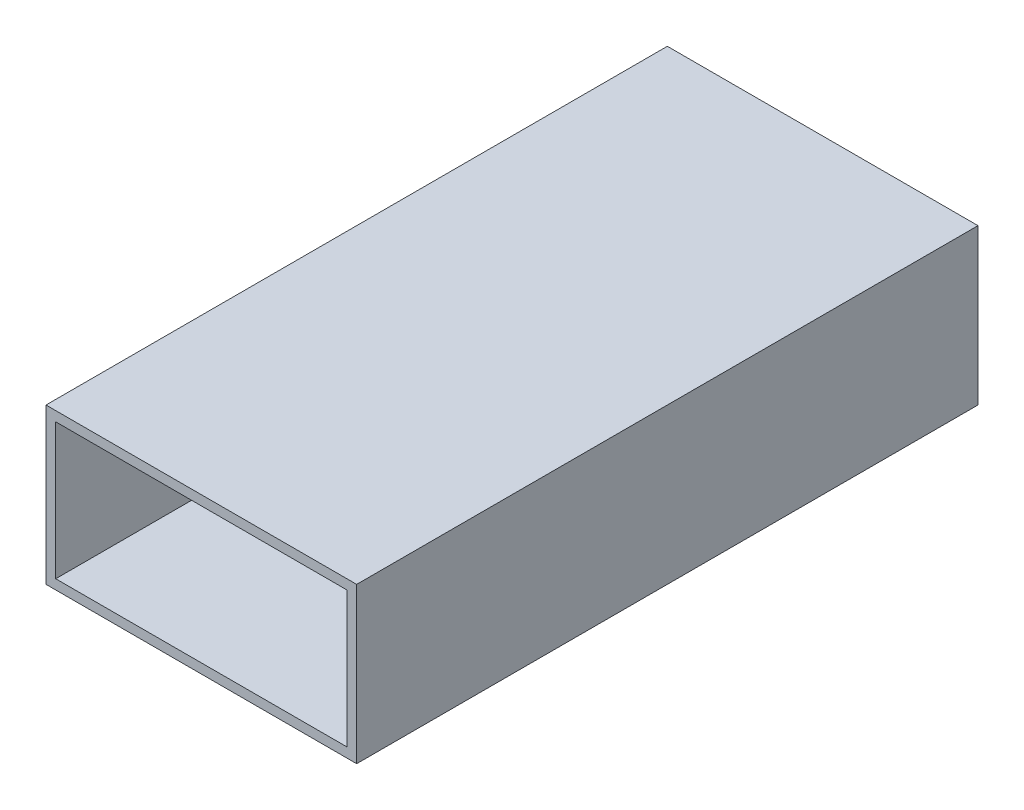
from build123d import *

# Parameters (mm, degrees)
SKETCH1_W           = 50.8
SKETCH1_H           = 25.4
SKETCH1_W_2         = 47.625
SKETCH1_H_2         = 22.225
BOSS_EXTRUDE1_DEPTH = 50.8


with BuildPart() as part:
    # Sketch1 → Boss-Extrude1 (new, symmetric)
    with BuildSketch(Plane.XY):
        Rectangle(SKETCH1_W, SKETCH1_H)
        Rectangle(SKETCH1_W_2, SKETCH1_H_2, mode=Mode.SUBTRACT)
    extrude(amount=BOSS_EXTRUDE1_DEPTH, both=True)


solid = part.part
